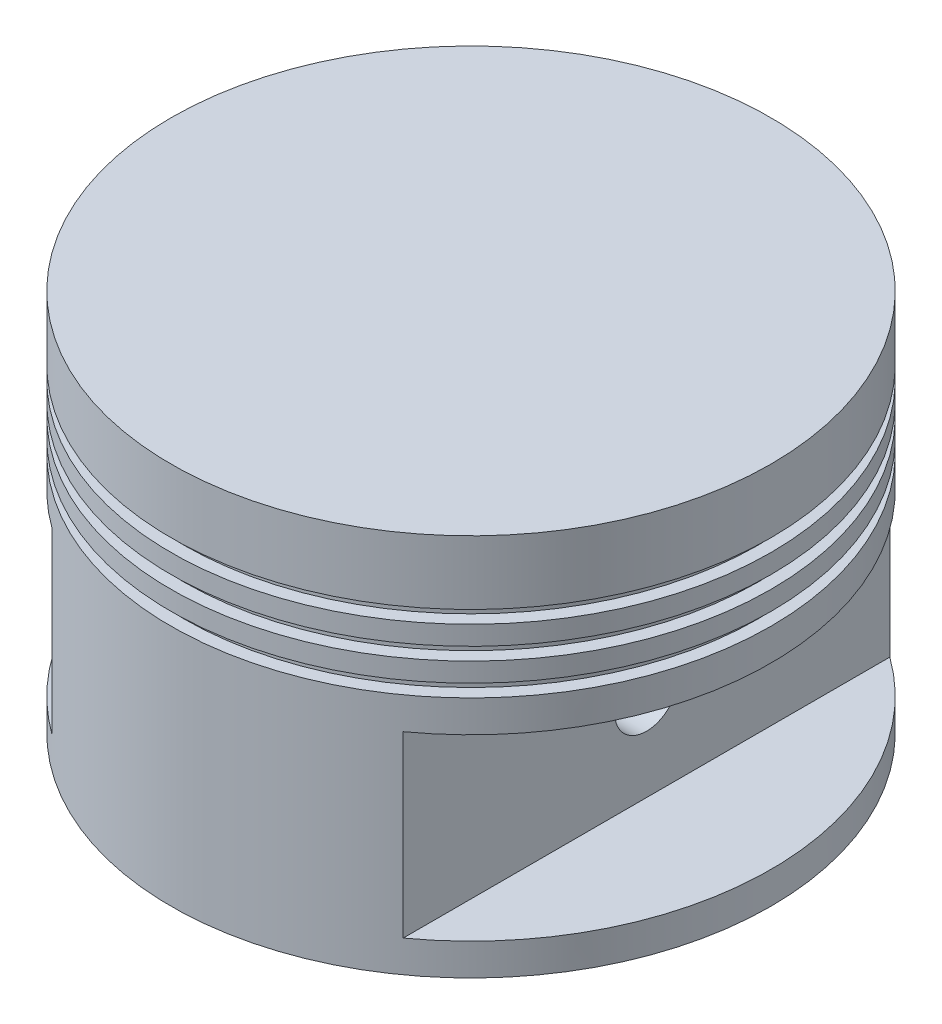
from build123d import *

# Parameters (mm, degrees)
CUT_EXTRUDE1_DEPTH      = 90.543285622
CUT_EXTRUDE1_DEPTH_BACK = 90.543285622
SKETCH3_W               = 20
SKETCH3_H               = 28
SHELL1_START            = -60
SHELL1_DEPTH            = 50
SHELL1_START_2          = -17
SHELL1_2_DEPTH          = 7
SHELL1_3_DEPTH          = 28
SKETCH4_R               = 41
BOSS_EXTRUDE2_DEPTH     = 18
CUT_EXTRUDE2_DEPTH      = 107.579782323
CUT_EXTRUDE2_DEPTH_BACK = 107.579782323
SKETCH5_R               = 5


# Read off the part's stored shape, not the designer's step: Shell1
with BuildPart() as part:
    # Sketch1 → Revolve1 (revolve)
    with BuildSketch(Plane.XY):
        Polygon((0, -60), (0, 0), (-47, 0), (-47, -10), (-45, -10), (-45, -12), (-47, -12), (-47, -15), (-45, -15), (-45, -17), (-47, -17), (-47, -20), (-45, -20), (-45, -22), (-47, -22), (-47, -60), align=None)
    revolve(axis=Axis((0, 0, 0), (0, -1, 0)))

    # Sketch3 → Cut-Extrude1 (cut, two sides: drawn at the far end of the back side and taken through both)
    with BuildSketch(Plane.XY.offset(-CUT_EXTRUDE1_DEPTH_BACK)):
        with Locations((-37.5, -41)):
            Rectangle(SKETCH3_W, SKETCH3_H)
        with Locations((37.5, -41)):
            Rectangle(SKETCH3_W, SKETCH3_H)
    extrude(amount=CUT_EXTRUDE1_DEPTH + CUT_EXTRUDE1_DEPTH_BACK, mode=Mode.SUBTRACT)

    # Shell1 outline → Shell1 (cut)
    with BuildSketch(Plane(origin=(0, 0, 0), x_dir=(1, 0, 0), z_dir=(0, 1, 0)).offset(SHELL1_START)):
        with BuildLine():
            Line((17.5, -30.310889132), (17.5, 30.310889132))
            ThreePointArc((17.5, 30.310889132), (0, 35), (-17.5, 30.310889132))
            Line((-17.5, 30.310889132), (-17.5, -30.310889132))
            ThreePointArc((-17.5, -30.310889132), (0, -35), (17.5, -30.310889132))
        make_face()
    extrude(amount=SHELL1_DEPTH, mode=Mode.SUBTRACT)

    # Shell1 2 outline → Shell1 2 (cut)
    with BuildSketch(Plane(origin=(0, 0, 0), x_dir=(1, 0, 0), z_dir=(0, 1, 0)).offset(SHELL1_START_2)):
        with BuildLine():
            ThreePointArc((17.5, -30.310889132), (35, 0), (17.5, 30.310889132))
            Line((17.5, 30.310889132), (17.5, -30.310889132))
        make_face()
        with BuildLine():
            Line((-17.5, -30.310889132), (-17.5, 30.310889132))
            ThreePointArc((-17.5, 30.310889132), (-35, 0), (-17.5, -30.310889132))
        make_face()
    extrude(amount=SHELL1_2_DEPTH, mode=Mode.SUBTRACT)

    # Shell1 3 outline → Shell1 3 (cut)
    with BuildSketch(Plane(origin=(0, 0, 0), x_dir=(1, 0, 0), z_dir=(0, 1, 0)).offset(SHELL1_START)):
        with BuildLine():
            Line((17.5, 30.310889132), (17.5, 32.599846625))
            ThreePointArc((17.5, 32.599846625), (0, 37), (-17.5, 32.599846625))
            Line((-17.5, 32.599846625), (-17.5, 30.310889132))
            ThreePointArc((-17.5, 30.310889132), (0, 35), (17.5, 30.310889132))
        make_face()
        with BuildLine():
            Line((17.5, -32.599846625), (17.5, -30.310889132))
            ThreePointArc((17.5, -30.310889132), (0, -35), (-17.5, -30.310889132))
            Line((-17.5, -30.310889132), (-17.5, -32.599846625))
            ThreePointArc((-17.5, -32.599846625), (0, -37), (17.5, -32.599846625))
        make_face()
    extrude(amount=SHELL1_3_DEPTH, mode=Mode.SUBTRACT)

    # Sketch4 → Boss-Extrude2 (add)
    with BuildSketch(Plane(origin=(0, 0, 0), x_dir=(1, 0, 0), z_dir=(0, 1, 0))):
        Circle(SKETCH4_R)
    extrude(amount=-BOSS_EXTRUDE2_DEPTH)

    # Sketch5 → Cut-Extrude2 (cut, two sides: drawn at the far end of the back side and taken through both)
    with BuildSketch(Plane(origin=(27.5, 0, 0), x_dir=(0, 0, -1), z_dir=(1, 0, 0)).offset(-CUT_EXTRUDE2_DEPTH_BACK)):
        with Locations(Location((0, -41, 0), (0, 0, 270))):
            Circle(SKETCH5_R)
    extrude(amount=CUT_EXTRUDE2_DEPTH + CUT_EXTRUDE2_DEPTH_BACK, mode=Mode.SUBTRACT)


solid = part.part
